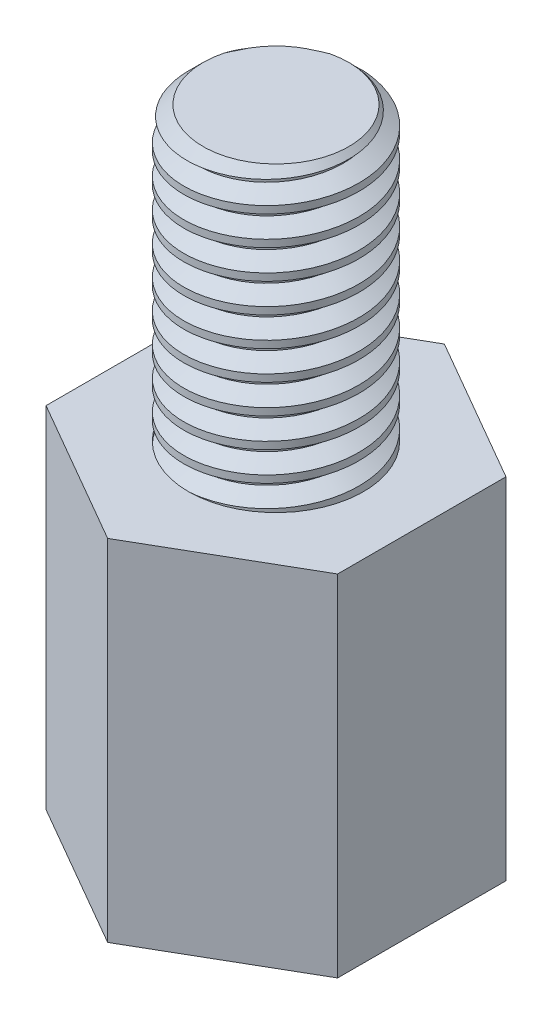
from build123d import *

# Parameters (mm, degrees)
BOSS_EXTRUDE1_DEPTH       = 6
SKETCH3_R                 = 1.5
BOSS_EXTRUDE2_DEPTH       = 5
M3X0_5_TAPPED_HOLE1_D     = 2.5
M3X0_5_TAPPED_HOLE1_DEPTH = 5.5
M3X0_5_TAPPED_HOLE1_TIP   = 0.751075774
CHAMFER1_SIZE             = 0.25
THREAD1_PITCH             = 0.5


with BuildPart() as part:
    # Sketch2 → Boss-Extrude1 (new body)
    with BuildSketch(Plane(origin=(0, 0, 0), x_dir=(1, 0, 0), z_dir=(0, 1, 0))):
        Polygon((1.25, 0.721687836), (-2.5, -1.443375673), (0, -2.886751346), (1.666666667, 0), align=None)
        Polygon((0.833333333, 1.443375673), (-2.5, 1.443375673), (-2.5, -1.443375673), (1.25, 0.721687836), align=None)
        Polygon((0.833333333, 1.443375673), (0, 2.886751346), (-2.5, 1.443375673), align=None)
        Polygon((2.5, 1.443375673), (0, 2.886751346), (0.833333333, 1.443375673), align=None)
        Polygon((1.25, 0.721687836), (2.5, 1.443375673), (0.833333333, 1.443375673), align=None)
        Polygon((1.666666667, 0), (2.5, 1.443375673), (1.25, 0.721687836), align=None)
        Polygon((2.5, -1.443375673), (2.5, 1.443375673), (1.666666667, 0), align=None)
        Polygon((0, -2.886751346), (2.5, -1.443375673), (1.666666667, 0), align=None)
    extrude(amount=BOSS_EXTRUDE1_DEPTH)

    # Sketch3 → Boss-Extrude2 (add)
    with BuildSketch(Plane(origin=(0, 6, 0), x_dir=(1, 0, 0), z_dir=(0, 1, 0))):
        with Locations(Location((0, 0, 0), (0, 0, 270))):
            Circle(SKETCH3_R)
    extrude(amount=BOSS_EXTRUDE2_DEPTH)

    # M3x0.5 Tapped Hole1
    with Locations(Plane(origin=(0, 0, 0), x_dir=(-1, 0, 0), z_dir=(0, -1, 0))):
        with Locations((0, 0)):
            Hole(M3X0_5_TAPPED_HOLE1_D / 2, depth=M3X0_5_TAPPED_HOLE1_DEPTH)
            with Locations((0, 0, -(M3X0_5_TAPPED_HOLE1_DEPTH + M3X0_5_TAPPED_HOLE1_TIP / 2))):  # 118° drill point
                Cone(0, M3X0_5_TAPPED_HOLE1_D / 2, M3X0_5_TAPPED_HOLE1_TIP, mode=Mode.SUBTRACT)

    # Chamfer1
    chamfer1_edges = [part.edges().sort_by_distance(p)[0] for p in [
        (0, 11, -1.5),
    ]]
    chamfer(chamfer1_edges, length=CHAMFER1_SIZE)

    # Thread1: the profile of Thread Profile1 profile screwed along a right-hand helix of 11 turns, 6 arcs to a turn; built about Z, then put on its axis
    thread1_z = Axis((0, 0, 0), (0, 0, 1))
    thread1_corners = [(1.5003, 0, -0.000173205), (1.229367063, 0, 0.156249999), (1.229367063, 0, 0.218749999), (1.5003, 0, 0.375173204)]
    with BuildLine(mode=Mode.PRIVATE) as thread1_profile:
        Line(thread1_corners[0], thread1_corners[1])
        Line(thread1_corners[1], thread1_corners[2])
        Line(thread1_corners[2], thread1_corners[3])
        Line(thread1_corners[3], thread1_corners[0])
    thread1_cap = Face(thread1_profile.wire())
    thread1_turn_angles = [0, 30, 60, 90, 120, 150, 180, 210, 240, 270, 300, 330, 360]
    thread1_turn_weights = [1, 0.8660254037844387, 1, 0.8660254037844387, 1, 0.8660254037844387, 1, 0.8660254037844387, 1, 0.8660254037844387, 1, 0.8660254037844387, 1]
    thread1_turn_rails = [Edge.make_bspline([Vector(p[0], p[1], 0).rotate(thread1_z, thread1_turn_angles[k]) / thread1_turn_weights[k] + Vector(0, 0, p[2] + THREAD1_PITCH * thread1_turn_angles[k] / 360) for k in range(13)], [0, 0, 0, 1, 1, 2, 2, 3, 3, 4, 4, 5, 5, 6, 6, 6], 2, thread1_turn_weights) for p in thread1_corners]
    thread1_turn_sides = [Face.make_surface_from_curves(thread1_turn_rails[p[0]], thread1_turn_rails[p[1]]) for p in [(0, 1), (1, 2), (2, 3), (3, 0)]]
    thread1 = Plane(origin=(0, 11.75, 0), x_dir=(-1, 0, 0), z_dir=(0, -1, 0)) * Solid(Shell([*[p.moved(Location((0, 0, THREAD1_PITCH * i))) for i in range(11) for p in thread1_turn_sides], thread1_cap, thread1_cap.rotate(thread1_z, 3960).moved(Location((0, 0, THREAD1_PITCH * 3960 / 360)))]))
    add(thread1, mode=Mode.SUBTRACT)


solid = part.part
